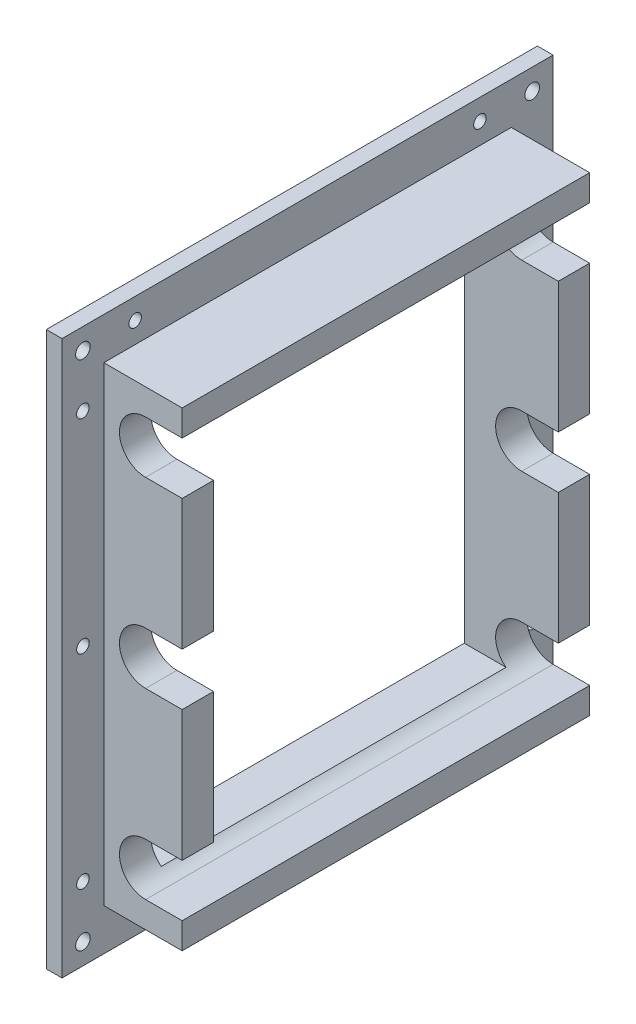
from build123d import *

# Parameters (mm, degrees)
SKETCH_1_W          = 470
SKETCH_1_H          = 530
SKETCH_1_R          = 7
SKETCH_1_R_2        = 6
SKETCH_1_W_2        = 330
SKETCH_1_H_2        = 390
EXTRUDE_1_DEPTH     = 15
SKETCH_2_W          = 390
SKETCH_2_H          = 450
SKETCH_2_W_2        = 330
SKETCH_2_H_2        = 390
EXTRUDE_2_DEPTH     = 75
CUT_EXTRUDE_1_DEPTH = 514.054577993


with BuildPart() as part:
    # 草图1 → 凸台-拉伸1 (new body)
    with BuildSketch(Plane(origin=(0, 0, 0), x_dir=(0, 0, -1), z_dir=(1, 0, 0))):
        Rectangle(SKETCH_1_W, SKETCH_1_H)
        with Locations((-215, 245)):
            Circle(SKETCH_1_R, mode=Mode.SUBTRACT)
        with Locations((-165, 245)):
            Circle(SKETCH_1_R_2, mode=Mode.SUBTRACT)
        with Locations((-215, 195)):
            Circle(SKETCH_1_R_2, mode=Mode.SUBTRACT)
        with Locations((215, 245)):
            Circle(SKETCH_1_R, mode=Mode.SUBTRACT)
        with Locations((165, 245)):
            Circle(SKETCH_1_R_2, mode=Mode.SUBTRACT)
        with Locations((215, 195)):
            Circle(SKETCH_1_R_2, mode=Mode.SUBTRACT)
        with Locations((-215, -195)):
            Circle(SKETCH_1_R_2, mode=Mode.SUBTRACT)
        with Locations((-165, -245)):
            Circle(SKETCH_1_R_2, mode=Mode.SUBTRACT)
        with Locations((-215, -245)):
            Circle(SKETCH_1_R, mode=Mode.SUBTRACT)
        with Locations((165, -245)):
            Circle(SKETCH_1_R_2, mode=Mode.SUBTRACT)
        with Locations((215, -245)):
            Circle(SKETCH_1_R, mode=Mode.SUBTRACT)
        with Locations((215, -195)):
            Circle(SKETCH_1_R_2, mode=Mode.SUBTRACT)
        with Locations((-215, 0)):
            Circle(SKETCH_1_R_2, mode=Mode.SUBTRACT)
        with Locations((215, 0)):
            Circle(SKETCH_1_R_2, mode=Mode.SUBTRACT)
        Rectangle(SKETCH_1_W_2, SKETCH_1_H_2, mode=Mode.SUBTRACT)
    extrude(amount=EXTRUDE_1_DEPTH)

    # 草图2 → 凸台-拉伸2 (add)
    with BuildSketch(Plane(origin=(15, 0, 0), x_dir=(0, 0, -1), z_dir=(1, 0, 0))):
        Rectangle(SKETCH_2_W, SKETCH_2_H)
        Rectangle(SKETCH_2_W_2, SKETCH_2_H_2, mode=Mode.SUBTRACT)
    extrude(amount=EXTRUDE_2_DEPTH)

    # 草图4 → 切除-拉伸1 (cut, through all)
    with BuildSketch(Plane.XY.offset(195)):
        with BuildLine():
            Line((90, 25), (55, 25))
            ThreePointArc((55, 25), (30, 0), (55, -25))
            Line((55, -25), (90, -25))
            Line((90, -25), (90, 25))
        make_face()
        with BuildLine():
            Line((90, 200), (55, 200))
            ThreePointArc((55, 200), (30, 175), (55, 150))
            Line((55, 150), (90, 150))
            Line((90, 150), (90, 200))
        make_face()
        with BuildLine():
            Line((90, -150), (90, -200))
            Line((90, -200), (55, -200))
            ThreePointArc((55, -200), (30, -175), (55, -150))
            Line((55, -150), (90, -150))
        make_face()
    extrude(amount=-CUT_EXTRUDE_1_DEPTH, mode=Mode.SUBTRACT)


solid = part.part
